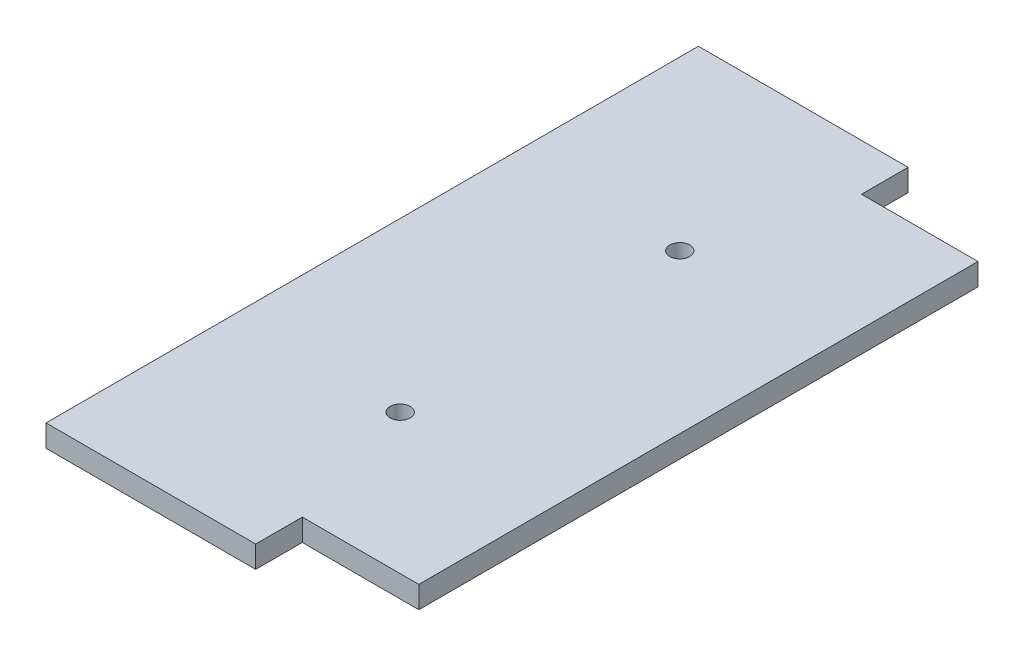
from build123d import *

# Parameters (mm, degrees)
BOSS_EXTRUDE1_DEPTH     = 5.9944
CUT_EXTRUDE2_DEPTH      = 199.87680315
CUT_EXTRUDE2_DEPTH_BACK = 199.87680315
SKETCH4_R               = 2.7305


with BuildPart() as part:
    # Sketch2 → Boss-Extrude1 (new body)
    with BuildSketch(Plane(origin=(0, 0, 0), x_dir=(1, 0, 0), z_dir=(0, 1, 0))):
        Polygon((0, 0), (57.15, 0), (57.15, 12.7), (88.9, 12.7), (88.9, 165.1), (57.15, 165.1), (57.15, 177.8), (0, 177.8), align=None)
    extrude(amount=BOSS_EXTRUDE1_DEPTH)

    # Sketch4 → Cut-Extrude2 (cut, two sides: drawn at the far end of the back side and taken through both)
    with BuildSketch(Plane(origin=(0, 5.9944, 0), x_dir=(1, 0, 0), z_dir=(0, 1, 0)).offset(-CUT_EXTRUDE2_DEPTH_BACK)):
        with Locations((45.72, 127)):
            Circle(SKETCH4_R)
        with Locations((45.72, 50.8)):
            Circle(SKETCH4_R)
    extrude(amount=CUT_EXTRUDE2_DEPTH + CUT_EXTRUDE2_DEPTH_BACK, mode=Mode.SUBTRACT)


solid = part.part
